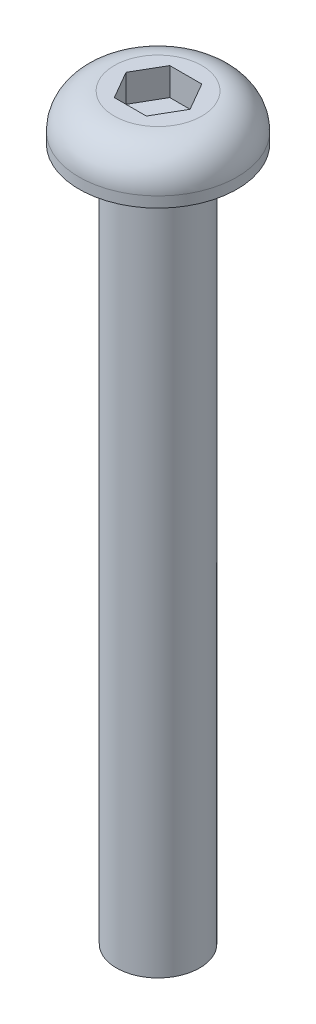
from build123d import *

# Parameters (mm, degrees)
CUT_EXTRUDE1_DEPTH = 1


with BuildPart() as part:
    # Sketch1 → Revolve1 (revolve)
    with BuildSketch(Plane.XY):
        with BuildLine():
            Line((1.5, 0), (2.85, 0))
            Line((2.85, 0), (2.85, 0.38))
            ThreePointArc((2.85, 0.38), (2.478025612, 1.278025612), (1.58, 1.65))
            Line((1.58, 1.65), (0, 1.65))
            Line((0, 1.65), (0, -25))
            Line((0, -25), (1.5, -25))
            Line((1.5, -25), (1.5, 0))
        make_face()
    revolve(axis=Axis((0, -25, 0), (0, 1, 0)))

    # Sketch2 → Cut-Extrude1 (cut)
    with BuildSketch(Plane(origin=(0, 1.65, 0), x_dir=(1, 0, 0), z_dir=(0, 1, 0))):
        Polygon((0.577350269, 1), (-0.577350269, 1), (-1.154700538, 0), (-0.577350269, -1), (0.577350269, -1), (1.154700538, 0), align=None)
    extrude(amount=-CUT_EXTRUDE1_DEPTH, mode=Mode.SUBTRACT)


solid = part.part
